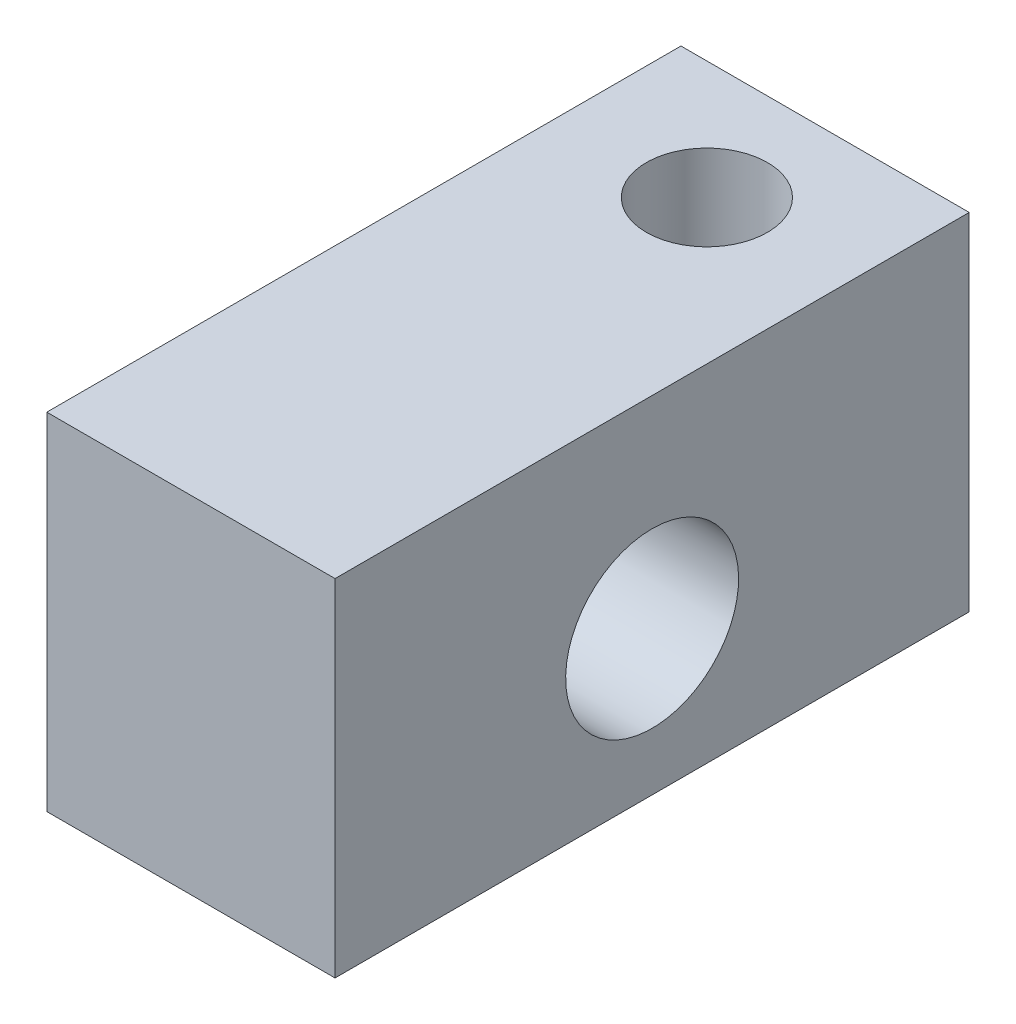
from build123d import *

# Parameters (mm, degrees)
SKETCH1_W           = 5
SKETCH1_H           = 6
BOSS_EXTRUDE1_DEPTH = 11
CUT_EXTRUDE1_REACH  = 15.491
SKETCH2_R           = 1.5
SKETCH3_R           = 1.05
CUT_EXTRUDE2_DEPTH  = 4
SKETCH4_R           = 1.05
CUT_EXTRUDE3_DEPTH  = 4


with BuildPart() as part:
    # Sketch1 → Boss-Extrude1 (new body)
    with BuildSketch(Plane.XY):
        with Locations((2.5, -3)):
            Rectangle(SKETCH1_W, SKETCH1_H)
    extrude(amount=BOSS_EXTRUDE1_DEPTH)

    # Sketch2 → Cut-Extrude1 (cut, up to next)
    with BuildSketch(Plane(origin=(5, 0, 0), x_dir=(0, 0, -1), z_dir=(1, 0, 0)), mode=Mode.PRIVATE) as cut_extrude1_sk1:
        with Locations((-5.5, -3.5)):
            Circle(SKETCH2_R)
    cut_extrude1_tool1 = extrude(cut_extrude1_sk1.sketch, amount=-CUT_EXTRUDE1_REACH, mode=Mode.PRIVATE) & part.part
    add(cut_extrude1_tool1.solids().sort_by_distance((5, -3.5, 5.5))[0], mode=Mode.SUBTRACT)

    # Sketch3 → Cut-Extrude2 (cut)
    with BuildSketch(Plane(origin=(0, 0, 0), x_dir=(1, 0, 0), z_dir=(0, 1, 0))):
        with Locations((2.5, -2.05)):
            Circle(SKETCH3_R)
    extrude(amount=-CUT_EXTRUDE2_DEPTH, mode=Mode.SUBTRACT)

    # Sketch4 → Cut-Extrude3 (cut)
    with BuildSketch(Plane.XZ.offset(6)):
        with Locations((2.5, 8.95)):
            Circle(SKETCH4_R)
    extrude(amount=-CUT_EXTRUDE3_DEPTH, mode=Mode.SUBTRACT)


solid = part.part
